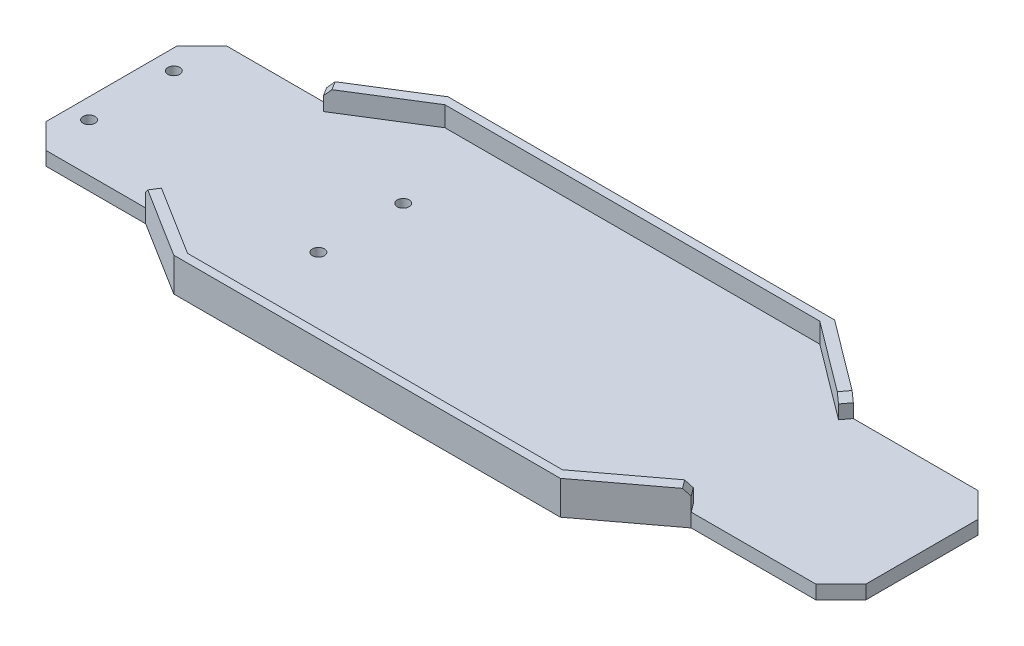
from build123d import *

# Parameters (mm, degrees)
BOSS_EXTRUDE1_DEPTH  = 5.5
CHASSIS_WALLS1_DEPTH = 8
CHAMFER1_SIZE        = 10
CHAMFER2_SIZE        = 10
CHAMFER3_SIZE        = 2.5
SKETCH4_R            = 2.4
CUT_EXTRUDE1_DEPTH   = 10


with BuildPart() as part:
    # Sketch1 → Boss-Extrude1 (new body)
    with BuildSketch(Plane(origin=(0, 0, 0), x_dir=(1, 0, 0), z_dir=(0, 1, 0))):
        Polygon((-107.5, 36.25), (-77.5, 55), (77.5, 55), (107.5, 32.5), (167.5, 32.5), (167.5, -32.5), (107.5, -32.5), (77.5, -55), (-77.5, -55), (-107.5, -36.25), (-157.5, -36.25), (-157.5, 36.25), align=None)
    extrude(amount=BOSS_EXTRUDE1_DEPTH)

    # Sketch3 → Chassis-Walls1 (add)
    with BuildSketch(Plane(origin=(0, 5.5, 0), x_dir=(1, 0, 0), z_dir=(0, 1, 0))):
        Polygon((0, 55), (-77.5, 55), (-107.5, 36.25), (-105.38000424, 32.858006784), (-75.38000424, 51.608006784), (0, 51.608006784), (74.956005088, 51.608006784), (104.956005088, 29.108006784), (107.5, 32.5), (77.5, 55), align=None)
        Polygon((74.956005088, -51.608006784), (0, -51.608006784), (-75.38000424, -51.608006784), (-105.38000424, -32.858006784), (-107.5, -36.25), (-77.5, -55), (0, -55), (77.5, -55), (107.5, -32.5), (104.956005088, -29.108006784), align=None)
    extrude(amount=CHASSIS_WALLS1_DEPTH)

    # Chamfer1
    chamfer1_edges = [part.edges().sort_by_distance(p)[0] for p in [
        (-157.5, 2.75, -36.25),
        (-157.5, 2.75, 36.25),
    ]]
    chamfer(chamfer1_edges, length=CHAMFER1_SIZE)

    # Chamfer2
    chamfer2_edges = [part.edges().sort_by_distance(p)[0] for p in [
        (167.5, 2.75, -32.5),
        (167.5, 2.75, 32.5),
    ]]
    chamfer(chamfer2_edges, length=CHAMFER2_SIZE)

    # Chamfer3
    chamfer3_edges = [part.edges().sort_by_distance(p)[0] for p in [
        (-106.44000212, 13.5, -34.554003392),
        (-106.44000212, 13.5, 34.554003392),
        (106.228002544, 13.5, 30.804003392),
        (106.228002544, 13.5, -30.804003392),
    ]]
    chamfer(chamfer3_edges, length=CHAMFER3_SIZE)

    # Sketch4 → Cut-Extrude1 (cut)
    with BuildSketch(Plane.XZ):
        with Locations((-149.5, 17)):
            Circle(SKETCH4_R)
        with Locations((-57.5, 17)):
            Circle(SKETCH4_R)
        with Locations((-57.5, -17)):
            Circle(SKETCH4_R)
        with Locations((-149.5, -17)):
            Circle(SKETCH4_R)
    extrude(amount=-CUT_EXTRUDE1_DEPTH, mode=Mode.SUBTRACT)


solid = part.part
